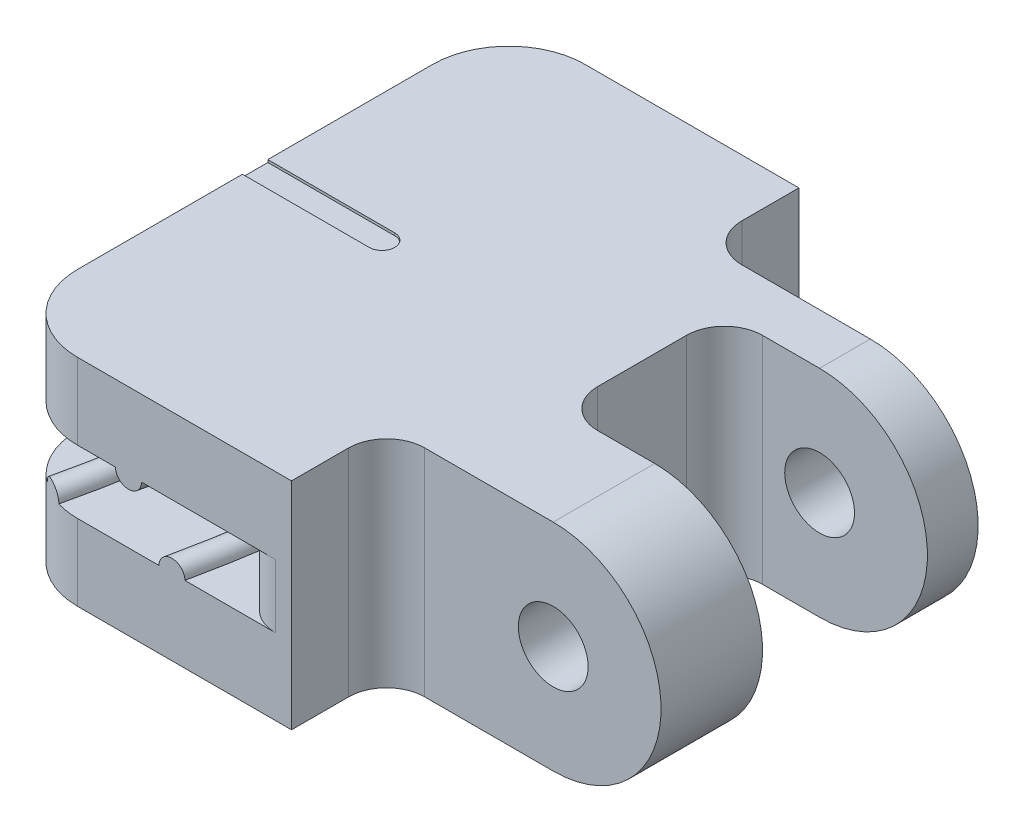
from build123d import *

# Parameters (mm, degrees)
SKETCH1_R               = 1.375
BOSS_EXTRUDE1_DEPTH     = 6.25
CUT_EXTRUDE1_DEPTH      = 15.811313244
CUT_EXTRUDE1_DEPTH_BACK = 15.811313244
SKETCH2_W               = 8
SKETCH2_H               = 6.5
BOSS_EXTRUDE2_START     = -10
BOSS_EXTRUDE2_OUTLINE_W = 11.434309127
BOSS_EXTRUDE2_OUTLINE_H = 8.5
BOSS_EXTRUDE2_DEPTH     = 20
FILLET4_R               = 1.5
FILLET5_R               = 1.5
FILLET6_R               = 3
CUT_EXTRUDE2_DEPTH      = 0.1


# Read off the part's stored shape, not the designer's step: Boss-Extrude2
with BuildPart() as part:
    # Sketch1 → Boss-Extrude1 (new, symmetric)
    with BuildSketch(Plane.XY):
        with BuildLine():
            Line((-10, 5.5), (-10, -3))
            Line((-10, -3), (8, -3))
            ThreePointArc((8, -3), (12.25, 1.25), (8, 5.5))
            Line((8, 5.5), (-10, 5.5))
        make_face()
        with Locations((8, 1.25)):
            Circle(SKETCH1_R, mode=Mode.SUBTRACT)
    extrude(amount=BOSS_EXTRUDE1_DEPTH, both=True)

    # Sketch2 → Cut-Extrude1 (cut, two sides: drawn at the far end of the back side and taken through both)
    with BuildSketch(Plane(origin=(0, 0, 0), x_dir=(1, 0, 0), z_dir=(0, 1, 0)).offset(-CUT_EXTRUDE1_DEPTH_BACK)):
        with Locations((8.25, 1)):
            Rectangle(SKETCH2_W, SKETCH2_H)
    extrude(amount=CUT_EXTRUDE1_DEPTH + CUT_EXTRUDE1_DEPTH_BACK, mode=Mode.SUBTRACT)

    # Boss-Extrude2 outline → Boss-Extrude2 (add)
    with BuildSketch(Plane.XY.offset(BOSS_EXTRUDE2_START)):
        with Locations((-4.282845436, 1.25)):
            Rectangle(BOSS_EXTRUDE2_OUTLINE_W, BOSS_EXTRUDE2_OUTLINE_H)
    extrude(amount=BOSS_EXTRUDE2_DEPTH)

    # Sketch1<5> → Cut-Revolve2 (revolve, cut)
    with BuildSketch(Plane.XY):
        with BuildLine():
            Line((-9.391951793, 2.5), (-10, 2.5))
            Line((-10, 2.5), (-10, 0))
            Line((-10, 0), (-7.720367157, 0))
            ThreePointArc((-7.720367157, 0), (-7.220367157, 0.5), (-6.720367157, 0))
            Line((-6.720367157, 0), (-2.720367157, 0))
            ThreePointArc((-2.720367157, 0), (-2.220367157, 0.5), (-1.720367157, 0))
            Line((-1.720367157, 0), (0, 0))
            Line((0, 0), (0, 2.5))
            Line((0, 2.5), (-3.391951793, 2.5))
            ThreePointArc((-3.391951793, 2.5), (-3.891951793, 2), (-4.391951793, 2.5))
            Line((-4.391951793, 2.5), (-8.391951793, 2.5))
            ThreePointArc((-8.391951793, 2.5), (-8.891951793, 2), (-9.391951793, 2.5))
        make_face()
    revolve(axis=Axis((-50, 0, 0), (0, 1, 0)), mode=Mode.SUBTRACT)

    # Fillet4
    fillet4_edges = [part.edges().sort_by_distance(p)[0] for p in [
        (4.25, 1.25, 2.25),
        (4.25, 1.25, -4.25),
    ]]
    fillet(fillet4_edges, radius=FILLET4_R)

    # Fillet5
    fillet5_edges = [part.edges().sort_by_distance(p)[0] for p in [
        (1.434309127, 1.25, -6.25),
        (1.434309127, 1.25, 6.25),
        (-1.010205144, 1.25, 10),
        (-1.010205144, 1.25, -10),
    ]]
    fillet(fillet5_edges, radius=FILLET5_R)

    # Fillet6
    fillet6_edges = [part.edges().sort_by_distance(p)[0] for p in [
        (-10, -1.5, -10),
        (-10, 3.757683564, -10),
        (-10, -1.5, 10),
        (-10, 3.757683564, 10),
    ]]
    fillet(fillet6_edges, radius=FILLET6_R)

    # Sketch5 → Cut-Extrude2 (cut)
    with BuildSketch(Plane(origin=(0, 5.5, 0), x_dir=(1, 0, 0), z_dir=(0, 1, 0))):
        with BuildLine():
            Line((-10, 0.5), (-5, 0.5))
            ThreePointArc((-5, 0.5), (-4.5, 0), (-5, -0.5))
            Line((-5, -0.5), (-10, -0.5))
            Line((-10, -0.5), (-10, 0.5))
        make_face()
    extrude(amount=-CUT_EXTRUDE2_DEPTH, mode=Mode.SUBTRACT)


solid = part.part
